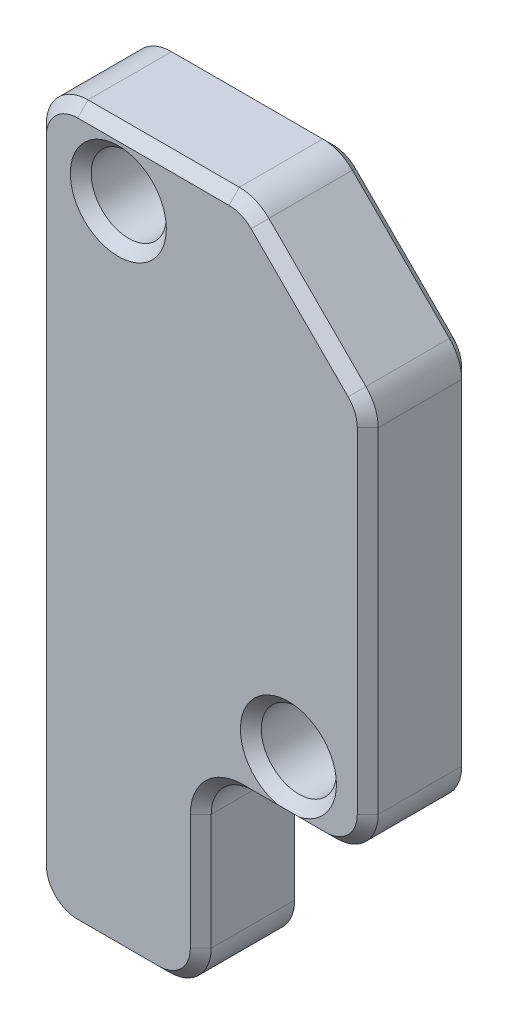
from build123d import *

# Parameters (mm, degrees)
SKIZZE1_R                       = 1.8
AUFSATZ_LINEAR_AUSTRAGEN1_DEPTH = 5
VERRUNDUNG1_R                   = 2
FASE1_SIZE                      = 0.5


with BuildPart() as part:
    # Skizze1 → Aufsatz-Linear austragen1 (new body)
    with BuildSketch(Plane.XY):
        Polygon((-0.2, 9.751346921), (-0.2, 28.627239348), (-6.022760652, 34.45), (-16.1, 34.45), (-16.1, 0.2), (-8.2, 0.2), (-8.2, 9.751346921), align=None)
        with Locations((-12.15, 31.475)):
            Circle(SKIZZE1_R, mode=Mode.SUBTRACT)
        with Locations((-4, 12.49111782)):
            Circle(SKIZZE1_R, mode=Mode.SUBTRACT)
    extrude(amount=AUFSATZ_LINEAR_AUSTRAGEN1_DEPTH)

    # Verrundung1
    verrundung1_edges = [part.edges().sort_by_distance(p)[0] for p in [
        (-8.2, 9.751346921, 2.5),
        (-8.2, 0.2, 2.5),
        (-16.1, 0.2, 2.5),
        (-16.1, 34.45, 2.5),
        (-6.022760652, 34.45, 2.5),
        (-0.2, 28.627239348, 2.5),
        (-0.2, 9.751346921, 2.5),
    ]]
    fillet(verrundung1_edges, radius=VERRUNDUNG1_R)

    # Fase1
    # the kernel refuses this chamfer: 0.5 mm, written as the material it takes off along each edge
    with BuildSketch(Plane(origin=(-12.15, 31.475, 0), x_dir=(1, 0, 0), z_dir=(0, -1, 0))) as fase1_piece_1:
        Polygon((1.8 + FASE1_SIZE, 0), (1.8, FASE1_SIZE), (1.8, 0), align=None)
    revolve(axis=Axis((-12.15, 31.475, 0), (0, 0, 1)), mode=Mode.SUBTRACT)
    with BuildSketch(Plane(origin=(-12.15, 31.475, 5), x_dir=(1, 0, 0), z_dir=(0, -1, 0))) as fase1_piece_2:
        Polygon((1.8 + FASE1_SIZE, 0), (1.8, -FASE1_SIZE), (1.8, 0), align=None)
    revolve(axis=Axis((-12.15, 31.475, 5), (0, 0, 1)), mode=Mode.SUBTRACT)
    with BuildSketch(Plane(origin=(-4, 12.49111782, 0), x_dir=(1, 0, 0), z_dir=(0, -1, 0))) as fase1_piece_3:
        Polygon((1.8 + FASE1_SIZE, 0), (1.8, FASE1_SIZE), (1.8, 0), align=None)
    revolve(axis=Axis((-4, 12.49111782, 0), (0, 0, 1)), mode=Mode.SUBTRACT)
    with BuildSketch(Plane(origin=(-4, 12.49111782, 5), x_dir=(1, 0, 0), z_dir=(0, -1, 0))) as fase1_piece_4:
        Polygon((1.8 + FASE1_SIZE, 0), (1.8, -FASE1_SIZE), (1.8, 0), align=None)
    revolve(axis=Axis((-4, 12.49111782, 5), (0, 0, 1)), mode=Mode.SUBTRACT)
    with BuildSketch(Plane(origin=(-0.2, 11.751346921, 0), x_dir=(0.027495876610586382, 0, 0.9996219169112968), z_dir=(0, 1, 0))) as fase1_piece_5:
        Polygon((FASE1_SIZE * 0.999621916911, -FASE1_SIZE * 0.0274958766106), (-FASE1_SIZE * 0.0274958766106, -FASE1_SIZE * 0.999621916911), (0, 0), align=None)
    extrude(amount=16.047465302, mode=Mode.SUBTRACT)
    with BuildSketch(Plane(origin=(-0.2, 11.751346921, 5), x_dir=(0.027495876610586403, 0, -0.9996219169112968), z_dir=(0, 1, 0))) as fase1_piece_6:
        Polygon((FASE1_SIZE * 0.999621916911, FASE1_SIZE * 0.0274958766106), (-FASE1_SIZE * 0.0274958766106, FASE1_SIZE * 0.999621916911), (0, 0), align=None)
    extrude(amount=16.047465302, mode=Mode.SUBTRACT)
    with BuildSketch(Plane(origin=(-6.2, 9.751346921, 0), x_dir=(0, 0.9996219169112968, -0.02749587661058639), z_dir=(1, 0, 0))) as fase1_piece_7:
        Polygon((FASE1_SIZE * 0.999621916911, FASE1_SIZE * 0.0274958766106), (-FASE1_SIZE * 0.0274958766106, FASE1_SIZE * 0.999621916911), (0, 0), align=None)
    extrude(amount=4, mode=Mode.SUBTRACT)
    with BuildSketch(Plane(origin=(-8.2, 2.2, 0), x_dir=(-0.9996219169112968, 0, -0.02749587661058639), z_dir=(0, 1, 0))) as fase1_piece_8:
        Polygon((FASE1_SIZE * 0.999621916911, FASE1_SIZE * 0.0274958766106), (-FASE1_SIZE * 0.0274958766106, FASE1_SIZE * 0.999621916911), (0, 0), align=None)
    extrude(amount=5.551346921, mode=Mode.SUBTRACT)
    with BuildSketch(Plane(origin=(-14.1, 0.2, 0), x_dir=(0, 0.9996219169112968, -0.027495876610586372), z_dir=(1, 0, 0))) as fase1_piece_9:
        Polygon((FASE1_SIZE * 0.999621916911, FASE1_SIZE * 0.0274958766106), (-FASE1_SIZE * 0.0274958766106, FASE1_SIZE * 0.999621916911), (0, 0), align=None)
    extrude(amount=3.9, mode=Mode.SUBTRACT)
    with BuildSketch(Plane(origin=(-16.1, 32.45, 0), x_dir=(0.9996219169112968, 0, -0.02749587661058639), z_dir=(0, -1, 0))) as fase1_piece_10:
        Polygon((FASE1_SIZE * 0.999621916911, FASE1_SIZE * 0.0274958766106), (-FASE1_SIZE * 0.0274958766106, FASE1_SIZE * 0.999621916911), (0, 0), align=None)
    extrude(amount=30.25, mode=Mode.SUBTRACT)
    with BuildSketch(Plane(origin=(-6.851187777, 34.45, 0), x_dir=(0, -0.9996219169112968, -0.027495876610586483), z_dir=(-1, 0, 0))) as fase1_piece_11:
        Polygon((FASE1_SIZE * 0.999621916911, FASE1_SIZE * 0.0274958766106), (-FASE1_SIZE * 0.0274958766106, FASE1_SIZE * 0.999621916911), (0, 0), align=None)
    extrude(amount=7.248812223, mode=Mode.SUBTRACT)
    with BuildSketch(Plane(origin=(-0.785786438, 29.213025785, 0), x_dir=(-0.7068394360706736, -0.7068394360706733, -0.027495876610586348), z_dir=(-0.7071067811865475, 0.7071067811865477, 0))) as fase1_piece_12:
        Polygon((FASE1_SIZE * 0.999621916911, FASE1_SIZE * 0.0274958766106), (-FASE1_SIZE * 0.0274958766106, FASE1_SIZE * 0.999621916911), (0, 0), align=None)
    extrude(amount=6.577772835, mode=Mode.SUBTRACT)
    with BuildSketch(Plane(origin=(-2.2, 27.798812223, 0), x_dir=(1, 0, 0), z_dir=(0, -1, 0))) as fase1_piece_13:
        Polygon((2 - FASE1_SIZE, 0), (2, FASE1_SIZE), (2, 0), align=None)
    revolve(axis=Axis((-2.2, 27.798812223, 0), (0, 0, 1)), revolution_arc=45, mode=Mode.SUBTRACT)
    with BuildSketch(Plane(origin=(-6.851187777, 32.45, 0), x_dir=(0.7071067811865487, 0.7071067811865465, 0), z_dir=(0.7071067811865465, -0.7071067811865487, 0))) as fase1_piece_14:
        Polygon((2 - FASE1_SIZE, 0), (2, FASE1_SIZE), (2, 0), align=None)
    revolve(axis=Axis((-6.851187777, 32.45, 0), (0, 0, 1)), revolution_arc=45, mode=Mode.SUBTRACT)
    with BuildSketch(Plane(origin=(-14.1, 32.45, 0), x_dir=(0, 1, 0), z_dir=(1, 0, 0))) as fase1_piece_15:
        Polygon((2 - FASE1_SIZE, 0), (2, FASE1_SIZE), (2, 0), align=None)
    revolve(axis=Axis((-14.1, 32.45, 0), (0, 0, 1)), revolution_arc=90, mode=Mode.SUBTRACT)
    with BuildSketch(Plane(origin=(-14.1, 2.2, 0), x_dir=(-1, 0, 0), z_dir=(0, 1, 0))) as fase1_piece_16:
        Polygon((2 - FASE1_SIZE, 0), (2, FASE1_SIZE), (2, 0), align=None)
    revolve(axis=Axis((-14.1, 2.2, 0), (0, 0, 1)), revolution_arc=90, mode=Mode.SUBTRACT)
    with BuildSketch(Plane(origin=(-10.2, 2.2, 0), x_dir=(0, -1, 0), z_dir=(-1, 0, 0))) as fase1_piece_17:
        Polygon((2 - FASE1_SIZE, 0), (2, FASE1_SIZE), (2, 0), align=None)
    revolve(axis=Axis((-10.2, 2.2, 0), (0, 0, 1)), revolution_arc=90, mode=Mode.SUBTRACT)
    with BuildSketch(Plane(origin=(-2.2, 11.751346921, 0), x_dir=(1, 0, 0), z_dir=(0, 1, 0))) as fase1_piece_18:
        Polygon((2 - FASE1_SIZE, 0), (2, -FASE1_SIZE), (2, 0), align=None)
    revolve(axis=Axis((-2.2, 11.751346921, 0), (0, 0, -1)), revolution_arc=90, mode=Mode.SUBTRACT)
    with BuildSketch(Plane(origin=(-6.2, 9.751346921, 5), x_dir=(0, 0.9996219169112968, 0.027495876610585647), z_dir=(1, 0, 0))) as fase1_piece_19:
        Polygon((FASE1_SIZE * 0.999621916911, -FASE1_SIZE * 0.0274958766106), (-FASE1_SIZE * 0.0274958766106, -FASE1_SIZE * 0.999621916911), (0, 0), align=None)
    extrude(amount=4, mode=Mode.SUBTRACT)
    with BuildSketch(Plane(origin=(-0.785786438, 29.213025785, 5), x_dir=(-0.7068394360706736, -0.7068394360706733, 0.027495876610585605), z_dir=(-0.7071067811865475, 0.7071067811865477, 0))) as fase1_piece_20:
        Polygon((FASE1_SIZE * 0.999621916911, -FASE1_SIZE * 0.0274958766106), (-FASE1_SIZE * 0.0274958766106, -FASE1_SIZE * 0.999621916911), (0, 0), align=None)
    extrude(amount=6.577772835, mode=Mode.SUBTRACT)
    with BuildSketch(Plane(origin=(-6.851187777, 34.45, 5), x_dir=(0, -0.9996219169112968, 0.02749587661058574), z_dir=(-1, 0, 0))) as fase1_piece_21:
        Polygon((FASE1_SIZE * 0.999621916911, -FASE1_SIZE * 0.0274958766106), (-FASE1_SIZE * 0.0274958766106, -FASE1_SIZE * 0.999621916911), (0, 0), align=None)
    extrude(amount=7.248812223, mode=Mode.SUBTRACT)
    with BuildSketch(Plane(origin=(-16.1, 32.45, 5), x_dir=(0.9996219169112968, 0, 0.027495876610585647), z_dir=(0, -1, 0))) as fase1_piece_22:
        Polygon((FASE1_SIZE * 0.999621916911, -FASE1_SIZE * 0.0274958766106), (-FASE1_SIZE * 0.0274958766106, -FASE1_SIZE * 0.999621916911), (0, 0), align=None)
    extrude(amount=30.25, mode=Mode.SUBTRACT)
    with BuildSketch(Plane(origin=(-14.1, 0.2, 5), x_dir=(0, 0.9996219169112968, 0.02749587661058563), z_dir=(1, 0, 0))) as fase1_piece_23:
        Polygon((FASE1_SIZE * 0.999621916911, -FASE1_SIZE * 0.0274958766106), (-FASE1_SIZE * 0.0274958766106, -FASE1_SIZE * 0.999621916911), (0, 0), align=None)
    extrude(amount=3.9, mode=Mode.SUBTRACT)
    with BuildSketch(Plane(origin=(-8.2, 2.2, 5), x_dir=(-0.9996219169112968, 0, 0.027495876610585647), z_dir=(0, 1, 0))) as fase1_piece_24:
        Polygon((FASE1_SIZE * 0.999621916911, -FASE1_SIZE * 0.0274958766106), (-FASE1_SIZE * 0.0274958766106, -FASE1_SIZE * 0.999621916911), (0, 0), align=None)
    extrude(amount=5.551346921, mode=Mode.SUBTRACT)
    with BuildSketch(Plane(origin=(-2.2, 27.798812223, 5), x_dir=(1, 0, 0), z_dir=(0, -1, 0))) as fase1_piece_25:
        Polygon((2, -FASE1_SIZE), (2 - FASE1_SIZE, 0), (2, 0), align=None)
    revolve(axis=Axis((-2.2, 27.798812223, 5), (0, 0, 1)), revolution_arc=45, mode=Mode.SUBTRACT)
    with BuildSketch(Plane(origin=(-6.851187777, 32.45, 5), x_dir=(0.7071067811865487, 0.7071067811865465, 0), z_dir=(0.7071067811865465, -0.7071067811865487, 0))) as fase1_piece_26:
        Polygon((2 - FASE1_SIZE, 0), (2, -FASE1_SIZE), (2, 0), align=None)
    revolve(axis=Axis((-6.851187777, 32.45, 5), (0, 0, 1)), revolution_arc=45, mode=Mode.SUBTRACT)
    with BuildSketch(Plane(origin=(-14.1, 32.45, 5), x_dir=(0, 1, 0), z_dir=(1, 0, 0))) as fase1_piece_27:
        Polygon((2 - FASE1_SIZE, 0), (2, -FASE1_SIZE), (2, 0), align=None)
    revolve(axis=Axis((-14.1, 32.45, 5), (0, 0, 1)), revolution_arc=90, mode=Mode.SUBTRACT)
    with BuildSketch(Plane(origin=(-14.1, 2.2, 5), x_dir=(-1, 0, 0), z_dir=(0, 1, 0))) as fase1_piece_28:
        Polygon((2 - FASE1_SIZE, 0), (2, -FASE1_SIZE), (2, 0), align=None)
    revolve(axis=Axis((-14.1, 2.2, 5), (0, 0, 1)), revolution_arc=90, mode=Mode.SUBTRACT)
    with BuildSketch(Plane(origin=(-10.2, 2.2, 5), x_dir=(0, -1, 0), z_dir=(-1, 0, 0))) as fase1_piece_29:
        Polygon((2 - FASE1_SIZE, 0), (2, -FASE1_SIZE), (2, 0), align=None)
    revolve(axis=Axis((-10.2, 2.2, 5), (0, 0, 1)), revolution_arc=90, mode=Mode.SUBTRACT)
    with BuildSketch(Plane(origin=(-2.2, 11.751346921, 5), x_dir=(1, 0, 0), z_dir=(0, 1, 0))) as fase1_piece_30:
        Polygon((2, FASE1_SIZE), (2 - FASE1_SIZE, 0), (2, 0), align=None)
    revolve(axis=Axis((-2.2, 11.751346921, 5), (0, 0, -1)), revolution_arc=90, mode=Mode.SUBTRACT)
    with BuildSketch(Plane(origin=(-6.2, 7.751346921, 0), x_dir=(-1, 0, 0), z_dir=(0, -1, 0))) as fase1_piece_31:
        Polygon((2 + FASE1_SIZE, 0), (2, -FASE1_SIZE), (2, 0), align=None)
    revolve(axis=Axis((-6.2, 7.751346921, 0), (0, 0, -1)), revolution_arc=90, mode=Mode.SUBTRACT)
    with BuildSketch(Plane(origin=(-6.2, 7.751346921, 5), x_dir=(-1, 0, 0), z_dir=(0, -1, 0))) as fase1_piece_32:
        Polygon((2 + FASE1_SIZE, 0), (2, FASE1_SIZE), (2, 0), align=None)
    revolve(axis=Axis((-6.2, 7.751346921, 5), (0, 0, -1)), revolution_arc=90, mode=Mode.SUBTRACT)


solid = part.part
